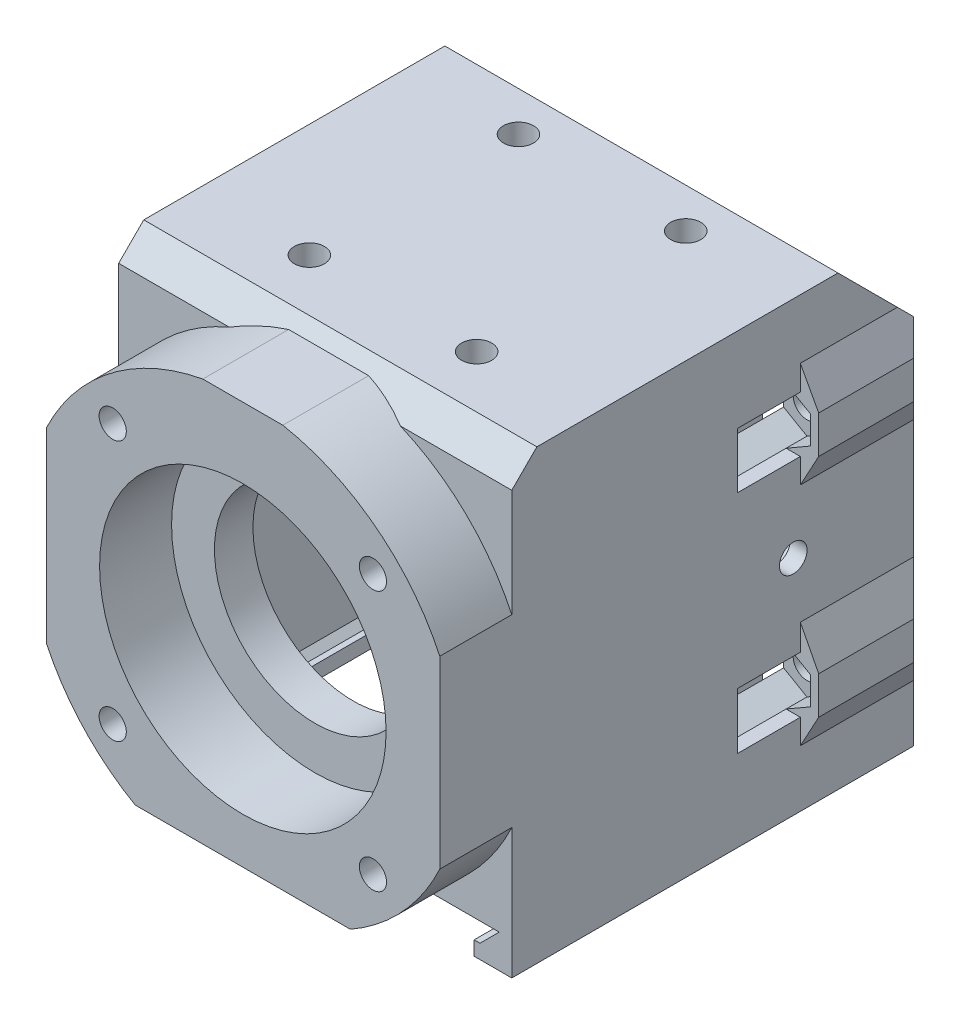
from build123d import *

# Parameters (mm, degrees)
SALIENTE_EXTRUIR11_DEPTH          = 4.6
SALIENTE_EXTRUIR12_DEPTH          = 48
CROQUIS13_W                       = 2.5
CROQUIS13_H                       = 3.996149892
SALIENTE_EXTRUIR16_DEPTH          = 40
REDONDEO1_SIZE                    = 1.5
REDONDEO1_SIZE_2                  = 5
CHAFL_N1_SIZE                     = 9
CORTAR_EXTRUIR4_DEPTH             = 37
CROQUIS15_R                       = 12
CORTAR_EXTRUIR6_DEPTH             = 4.6
CUT_EXTRUDE1_REACH                = 77.62
CUT_EXTRUDE1_DIRECTION_2_DEPTH    = 2
SKETCH2_R                         = 1.651428811
CUT_EXTRUDE2_DEPTH                = 11
CUT_EXTRUDE3_DEPTH                = 6
BOSS_EXTRUDE1_DEPTH               = 11
BOSS_EXTRUDE2_DEPTH               = 2.5
BOSS_EXTRUDE2_DEPTH_BACK          = 11
SKETCH6_W                         = 4.641732529
SKETCH6_H                         = 6.732997007
SKETCH6_W_2                       = 4.641448228
SKETCH6_H_2                       = 6.661529239
SKETCH6_W_3                       = 4.511392832
SKETCH6_H_3                       = 6.732997006
SKETCH6_W_4                       = 5.245953652
SKETCH6_H_4                       = 6.661529238
CUT_EXTRUDE4_DEPTH                = 3.5
CHAMFER1_SIZE                     = 2.19
CUT_EXTRUDE5_REACH                = 90.412
CORTAR_EXTRUIR7_DEPTH             = 21.498089
CORTAR_EXTRUIR7_DEPTH_BACK        = 21.498089
CROQUIS16_R                       = 1.65
CORTAR_EXTRUIR8_REACH             = 78.36
CROQUIS16_3_R                     = 1.65
CORTAR_EXTRUIR8_DIRECTION_2_REACH = 78.36
SALIENTE_EXTRUIR17_DEPTH          = 5.5
CHAFL_N2_SIZE                     = 2
CROQUIS19_R                       = 1.625
CROQUIS19_R_2                     = 17.125
SALIENTE_EXTRUIR18_DEPTH          = 8.606149892
CROQUIS20_R                       = 3
CORTAR_EXTRUIR9_DEPTH             = 10.206149892
CHAFL_N3_SIZE                     = 3
CHAFL_N4_SIZE                     = 4
CORTAR_EXTRUIR10_DEPTH            = 72.633260475
CHAFL_N5_SIZE                     = 1.8


with BuildPart() as part:
    # Croquis10 → Saliente-Extruir11 (new body)
    with BuildSketch(Plane.XY):
        Polygon((23.496383882, 3.993997574), (23.496905038, 53.492784374), (-23.503094962, 53.49282208), (-23.49750042, 3.993997574), align=None)
    extrude(amount=-SALIENTE_EXTRUIR11_DEPTH)

    # Croquis11 → Saliente-Extruir12 (add)
    with BuildSketch(Plane.XY):
        Polygon((-19.004304415, 46.48929276), (18.991873474, 46.49358723), (18.997129163, -0.007168252), (23.496341754, -0.007215623), (23.496905038, 53.492784374), (-23.503094962, 53.49282208), (-23.497048192, -0.007177578), (-18.999049268, -0.006669197), align=None)
    extrude(amount=-SALIENTE_EXTRUIR12_DEPTH)

    # Croquis13 → Saliente-Extruir16 (add)
    with BuildSketch(Plane(origin=(-0.005254636, 46.491440103, 0), x_dir=(0.9999999936128172, 0.0001130237387941988, 0), z_dir=(0.0001130237387941988, -0.9999999936128172, 0))):
        with Locations((-17.7490499, -46.001925054)):
            Rectangle(CROQUIS13_W, CROQUIS13_H)
        Polygon((17.000501156, -40.094972568), (17.000501156, -41.594973522), (18.9990499, -41.594973522), (18.9990499, -37.711974102), align=None)
        Polygon((-18.9990499, -37.711974102), (-17.000501156, -40.094972568), (-17.000501156, -41.594973522), (-18.9990499, -41.594973522), align=None)
        with Locations((17.7490499, -46.001925054)):
            Rectangle(CROQUIS13_W, CROQUIS13_H)
    extrude(amount=SALIENTE_EXTRUIR16_DEPTH)

    # Redondeo1
    # a fillet whose section is not a circle: 5, 1.5 mm, written as the material it takes off along each edge
    with BuildSketch(Plane(origin=(-4.501234814, 6.490931695, -41.594973522), x_dir=(0, 0, 1), z_dir=(-0.9999999936128172, -0.0001130237387941988, 0))) as redondeo1_piece_1:
        with BuildLine():
            Bezier((REDONDEO1_SIZE, 0), (0, 0), (0, REDONDEO1_SIZE_2), weights=[1, 0.707106781, 1])
            Line((0, REDONDEO1_SIZE_2), (0, 0))
            Line((0, 0), (REDONDEO1_SIZE, 0))
        make_face()
    extrude(amount=14.498548744, mode=Mode.SUBTRACT)
    with BuildSketch(Plane(origin=(-27.032212232, 6.48838516, -28.134391563), x_dir=(-0.00011302373879409797, 0.9999999936128171, 0), z_dir=(0.6425943013403179, 7.26284109292197e-05, -0.7662066030843527))) as redondeo1_piece_2_section:
        with BuildLine():
            Bezier((REDONDEO1_SIZE_2, 0), (0, 0), (0, -REDONDEO1_SIZE), weights=[1, 0.707106781, 1])
            Line((0, -REDONDEO1_SIZE), (0, 0))
            Line((0, 0), (REDONDEO1_SIZE_2, 0))
        make_face()
    redondeo1_piece_2 = extrude(amount=28.110125202, mode=Mode.PRIVATE)
    redondeo1_piece_2 = split(redondeo1_piece_2, bisect_by=Plane(origin=(-18.999783466, 6.489293015, -28.134391563), z_dir=(0.9999999936128172, 0.00011302373879382121, 0)), keep=Keep.TOP, mode=Mode.PRIVATE)
    add(redondeo1_piece_2, mode=Mode.SUBTRACT)
    with BuildSketch(Plane(origin=(-18.999783466, 6.489293015, -44.003850108), x_dir=(-0.00011302373879419882, 0.9999999936128173, 0), z_dir=(0.9999999936128172, 0.0001130237387941988, 0))) as redondeo1_piece_3:
        with BuildLine():
            Bezier((REDONDEO1_SIZE_2, 0), (0, 0), (0, -REDONDEO1_SIZE), weights=[1, 0.707106781, 1])
            Line((0, -REDONDEO1_SIZE), (0, 0))
            Line((0, 0), (REDONDEO1_SIZE_2, 0))
        make_face()
    extrude(amount=15, mode=Mode.SUBTRACT)
    with BuildSketch(Plane(origin=(18.996394423, 6.493587485, -44.003850108), x_dir=(0, 0, -1), z_dir=(-0.9999999936128172, -0.0001130237387941988, 0))) as redondeo1_piece_4:
        with BuildLine():
            Bezier((REDONDEO1_SIZE, 0), (0, 0), (0, -REDONDEO1_SIZE_2), weights=[1, 0.707106781, 1])
            Line((0, -REDONDEO1_SIZE_2), (0, 0))
            Line((0, 0), (REDONDEO1_SIZE, 0))
        make_face()
    extrude(amount=14.998078331, mode=Mode.SUBTRACT)
    with BuildSketch(Plane(origin=(4.49976744, 6.491949022, -41.594973522), x_dir=(-0.00011302373879419881, 0.9999999936128173, 0), z_dir=(0.9999999936128172, 0.0001130237387941988, 0))) as redondeo1_piece_5:
        with BuildLine():
            Bezier((REDONDEO1_SIZE_2, 0), (0, 0), (0, REDONDEO1_SIZE), weights=[1, 0.707106781, 1])
            Line((0, REDONDEO1_SIZE), (0, 0))
            Line((0, 0), (REDONDEO1_SIZE_2, 0))
        make_face()
    extrude(amount=14.496627075, mode=Mode.SUBTRACT)
    with BuildSketch(Plane(origin=(27.02882319, 6.49449534, -28.136682893), x_dir=(0.7662065981904509, 8.65995349694042e-05, -0.6425943054446852), z_dir=(-0.6425943013403179, -7.26284109292197e-05, -0.7662066030843527))) as redondeo1_piece_6_section:
        with BuildLine():
            Bezier((REDONDEO1_SIZE, 0), (0, 0), (0, -REDONDEO1_SIZE_2), weights=[1, 0.707106781, 1])
            Line((0, -REDONDEO1_SIZE_2), (0, 0))
            Line((0, 0), (REDONDEO1_SIZE, 0))
        make_face()
    redondeo1_piece_6 = extrude(amount=28.107134717, mode=Mode.PRIVATE)
    redondeo1_piece_6 = split(redondeo1_piece_6, bisect_by=Plane(origin=(18.996394423, 6.493587485, -28.136682893), z_dir=(-0.9999999936128172, -0.00011302373879380638, 0)), keep=Keep.TOP, mode=Mode.PRIVATE)
    add(redondeo1_piece_6, mode=Mode.SUBTRACT)

    # Chaflán1
    # the kernel refuses this chamfer: 9 mm, written as the material it takes off along each edge
    with BuildSketch(Plane(origin=(46.64205193, 53.492765806, -48), x_dir=(-8.022596244443855e-07, -0.999999999999678, 0), z_dir=(-0.9999999999996783, 8.022596244443856e-07, 0))) as chafl_n1_piece_1:
        Polygon((CHAFL_N1_SIZE, 0), (0, CHAFL_N1_SIZE), (0, 0), align=None)
    extrude(amount=93.290293783, mode=Mode.SUBTRACT)

    # Croquis14 → Cortar-Extruir4 (cut)
    with BuildSketch(Plane.XY):
        Polygon((18.99693689, 1.693999485), (19.699495603, 1.693999775), (21.999493409, 3.993997581), (18.996676936, 3.993997574), align=None)
        Polygon((-21.999502182, 3.993997591), (-19.699500787, 1.693999797), (-18.999241484, 1.693999797), (-18.999501438, 3.993997574), align=None)
    extrude(amount=-CORTAR_EXTRUIR4_DEPTH, mode=Mode.SUBTRACT)

    # Croquis15 → Cortar-Extruir6 (cut)
    with BuildSketch(Plane.XY):
        with Locations((-0.052055081, 26.591434374)):
            Circle(CROQUIS15_R)
    extrude(amount=-CORTAR_EXTRUIR6_DEPTH, mode=Mode.SUBTRACT)

    # Cut-Extrude1: up to this plane
    cut_extrude1_end = Plane(origin=(23.496905038, 53.492784374, -39), z_dir=(5.672832207026034e-07, 0.7071067811863239, -0.7071067811865436))
    # Sketch1 → Cut-Extrude1 (cut, up to the surface)
    with BuildSketch(Plane(origin=(5.11e-07, -0.004521854, 0), x_dir=(0.9999999936128173, 0.00011302373879411405, 0), z_dir=(0.00011302373879411405, -0.9999999936128173, 0)), mode=Mode.PRIVATE) as cut_extrude1_sk1:
        Polygon((-16.4990499, -45.503850108), (-20.063921392, -48), (-16.4990499, -48), align=None)
    cut_extrude1_tool1 = split(extrude(cut_extrude1_sk1.sketch, amount=-CUT_EXTRUDE1_REACH, mode=Mode.PRIVATE), bisect_by=cut_extrude1_end, keep=Keep.BOTH, mode=Mode.PRIVATE)
    add(cut_extrude1_tool1.solids().sort_by_distance((-17.68734, -0.006521, -47.16795))[0], mode=Mode.SUBTRACT)
    # Sketch1 → Cut-Extrude1 (cut, up to the surface)
    with BuildSketch(Plane(origin=(5.11e-07, -0.004521854, 0), x_dir=(0.9999999936128173, 0.00011302373879411405, 0), z_dir=(0.00011302373879411405, -0.9999999936128173, 0)), mode=Mode.PRIVATE) as cut_extrude1_sk2:
        Polygon((16.4990499, -45.503850108), (16.4990499, -48), (20.063921392, -48), align=None)
    cut_extrude1_tool2 = split(extrude(cut_extrude1_sk2.sketch, amount=-CUT_EXTRUDE1_REACH, mode=Mode.PRIVATE), bisect_by=cut_extrude1_end, keep=Keep.BOTH, mode=Mode.PRIVATE)
    add(cut_extrude1_tool2.solids().sort_by_distance((17.687341, -0.002523, -47.16795))[0], mode=Mode.SUBTRACT)

    # Sketch1 → Cut-Extrude1 direction 2 (cut)
    with BuildSketch(Plane(origin=(5.11e-07, -0.004521854, 0), x_dir=(0.9999999936128173, 0.00011302373879411405, 0), z_dir=(0.00011302373879411405, -0.9999999936128173, 0))):
        Polygon((-16.4990499, -45.503850108), (-20.063921392, -48), (-16.4990499, -48), align=None)
        Polygon((16.4990499, -45.503850108), (16.4990499, -48), (20.063921392, -48), align=None)
    extrude(amount=CUT_EXTRUDE1_DIRECTION_2_DEPTH, mode=Mode.SUBTRACT)

    # Sketch2 → Cut-Extrude2 (cut)
    with BuildSketch(Plane(origin=(0, 0, -37), x_dir=(-1, 0, 0), z_dir=(0, 0, -1))):
        with Locations(Location((-21.792312671, 13.089955334, 0), (0, 0, 180))):
            Circle(SKETCH2_R)
        with Locations(Location((-21.792596972, 40.092453426, 0), (0, 0, 180))):
            Circle(SKETCH2_R)
        with Locations((21.896707133, 13.090415321)):
            Circle(SKETCH2_R)
        with Locations((21.896422832, 40.092913413)):
            Circle(SKETCH2_R)
    extrude(amount=CUT_EXTRUDE2_DEPTH, mode=Mode.SUBTRACT)

    # Sketch3 → Cut-Extrude3 (cut)
    with BuildSketch(Plane(origin=(0, 0, -37), x_dir=(-1, 0, 0), z_dir=(0, 0, -1))):
        Polygon((-24.692596972, 38.418137645), (-21.792596972, 36.743821865), (-18.892596972, 38.418137645), (-18.892596972, 41.766769207), (-21.792596972, 43.441084987), (-24.692596972, 41.766769207), align=None)
        Polygon((-24.692312671, 14.764271115), (-24.692312671, 11.415639553), (-21.792312671, 9.741323773), (-18.892312671, 11.415639553), (-18.892312671, 14.764271115), (-21.792312671, 16.438586895), align=None)
        Polygon((24.796707133, 14.764731102), (21.896707133, 16.439046883), (18.996707133, 14.764731102), (18.996707133, 11.416099541), (21.896707133, 9.74178376), (24.796707133, 11.416099541), align=None)
        Polygon((24.796422832, 41.767229194), (21.896422832, 43.441544975), (18.996422832, 41.767229194), (18.996422832, 38.418597633), (21.896422832, 36.744281852), (24.796422832, 38.418597633), align=None)
    extrude(amount=-CUT_EXTRUDE3_DEPTH, mode=Mode.SUBTRACT)

    # Sketch4 → Boss-Extrude1 (add)
    with BuildSketch(Plane(origin=(0, 0, -37), x_dir=(-1, 0, 0), z_dir=(0, 0, -1))):
        with BuildLine():
            Line((21.896707133, 9.74178376), (24.796707133, 11.416099541))
            Line((24.796707133, 11.416099541), (24.796707133, 14.764731102))
            Line((24.796707133, 14.764731102), (21.896707133, 16.439046883))
            Line((21.896707133, 16.439046883), (21.896707133, 14.741844132))
            ThreePointArc((21.896707133, 14.741844132), (23.548135943, 13.090415321), (21.896707133, 11.438986511))
            Line((21.896707133, 11.438986511), (21.896707133, 9.74178376))
        make_face()
        with BuildLine():
            Line((21.896422832, 36.744281852), (24.796422832, 38.418597633))
            Line((24.796422832, 38.418597633), (24.796422832, 41.767229194))
            Line((24.796422832, 41.767229194), (21.896422832, 43.441544975))
            Line((21.896422832, 43.441544975), (21.896422832, 41.744342224))
            ThreePointArc((21.896422832, 41.744342224), (23.547851643, 40.092913413), (21.896422832, 38.441484603))
            Line((21.896422832, 38.441484603), (21.896422832, 36.744281852))
        make_face()
        with BuildLine():
            Line((-24.692312671, 11.415639553), (-21.792312671, 9.741323773))
            Line((-21.792312671, 9.741323773), (-21.792312671, 11.438526523))
            ThreePointArc((-21.792312671, 11.438526523), (-23.443741482, 13.089955334), (-21.792312671, 14.741384145))
            Line((-21.792312671, 14.741384145), (-21.792312671, 16.438586895))
            Line((-21.792312671, 16.438586895), (-24.692312671, 14.764271115))
            Line((-24.692312671, 14.764271115), (-24.692312671, 11.415639553))
        make_face()
        with BuildLine():
            Line((-24.692596972, 38.418137645), (-21.792596972, 36.743821865))
            Line((-21.792596972, 36.743821865), (-21.792596972, 38.441024615))
            ThreePointArc((-21.792596972, 38.441024615), (-23.444025782, 40.092453426), (-21.792596972, 41.743882237))
            Line((-21.792596972, 41.743882237), (-21.792596972, 43.441084987))
            Line((-21.792596972, 43.441084987), (-24.692596972, 41.766769207))
            Line((-24.692596972, 41.766769207), (-24.692596972, 38.418137645))
        make_face()
    extrude(amount=BOSS_EXTRUDE1_DEPTH)

    # Sketch5 → Boss-Extrude2 (add, two sides: drawn at the far end of the back side and taken through both)
    with BuildSketch(Plane.XY.offset(-37).offset(-BOSS_EXTRUDE2_DEPTH_BACK)):
        Polygon((-24.796422832, 41.767229194), (-21.896422832, 43.441544975), (-23.502273295, 46.222959565), (-25.796422832, 42.344579463), (-25.796422832, 37.841247364), (-23.500887885, 33.965266863), (-21.896422832, 36.744281852), (-24.796422832, 38.418597633), align=None)
        Polygon((-24.796707133, 14.764731102), (-21.896707133, 16.439046883), (-23.499232783, 19.321423675), (-25.796707133, 15.342081371), (-25.796707133, 10.838749272), (-23.497836614, 6.968546149), (-21.896707133, 9.74178376), (-24.796707133, 11.416099541), align=None)
        Polygon((24.692312671, 11.415639553), (21.792312671, 9.741323773), (23.496413317, 6.789734873), (25.692312671, 10.838289284), (25.692312671, 15.341621384), (23.496547988, 19.580665971), (21.792312671, 16.438586895), (24.692312671, 14.764271115), align=None)
        Polygon((24.692596972, 38.418137645), (21.792596972, 36.743821865), (23.496697617, 33.792232965), (25.692596972, 37.840787376), (25.692596972, 42.344119476), (23.496830286, 46.392903676), (21.792596972, 43.441084987), (24.692596972, 41.766769207), align=None)
    extrude(amount=BOSS_EXTRUDE2_DEPTH + BOSS_EXTRUDE2_DEPTH_BACK)

    # Sketch6 → Cut-Extrude4 (cut)
    with BuildSketch(Plane.XY.offset(-34.5)):
        with Locations((-24.217289097, 40.075046472)):
            Rectangle(SKETCH6_W, SKETCH6_H)
        with Locations((-24.217431247, 13.108282264)):
            Rectangle(SKETCH6_W_2, SKETCH6_H_2)
        with Locations((24.048009087, 13.107822276)):
            Rectangle(SKETCH6_W_3, SKETCH6_H_3)
        with Locations((24.415573798, 40.074586484)):
            Rectangle(SKETCH6_W_4, SKETCH6_H_4)
    extrude(amount=CUT_EXTRUDE4_DEPTH, mode=Mode.SUBTRACT)

    # Chamfer1
    chamfer1_edges = [part.edges().sort_by_distance(p)[0] for p in [
        (-25.796422832, 40.092913413, -48),
        (-25.796707133, 13.090415321, -48),
        (25.692312671, 13.089955334, -48),
        (25.692596972, 40.092453426, -48),
    ]]
    chamfer(chamfer1_edges, length=CHAMFER1_SIZE)

    # Cut-Extrude5: up to this face of the body (flat: up to its plane)
    cut_extrude5_end = Plane(part.part.faces().sort_by_distance((-25.796422832, 40.092913413, -40.155))[0])
    # Sketch8 → Cut-Extrude5 (cut, up to the picked face)
    with BuildSketch(Plane(origin=(25.692596972, 0, 0), x_dir=(0, 0, -1), z_dir=(1, 0, 0)), mode=Mode.PRIVATE) as cut_extrude5_sk1:
        Polygon((48, 44.492784374), (39, 53.492784374), (48, 53.492784374), align=None)
    cut_extrude5_tool1 = split(extrude(cut_extrude5_sk1.sketch, amount=-CUT_EXTRUDE5_REACH, mode=Mode.PRIVATE), bisect_by=cut_extrude5_end, keep=Keep.BOTH, mode=Mode.PRIVATE)
    add(cut_extrude5_tool1.solids().sort_by(Axis((25.692597, 50.492784, -45), (-1, 0, 0)))[0], mode=Mode.SUBTRACT)

    # Croquis16 → Cortar-Extruir7 (cut, two sides: drawn at the far end of the back side and taken through both)
    # profile 1 of 2: a face of its own
    with BuildSketch(Plane(origin=(-0.000960834, -1.09e-07, 0), x_dir=(0, 0, 1), z_dir=(-0.9999999936128173, -0.00011302373879384934, 0)).offset(-CORTAR_EXTRUIR7_DEPTH_BACK)):
        Polygon((-36.454091828, 25.02942041), (-33.654091828, 23.412839656), (-30.854091828, 25.02942041), (-30.854091828, 28.262581917), (-33.654091828, 29.879162671), (-36.454091828, 28.262581917), align=None)
        with Locations((-33.654091828, 26.646001163)):
            Circle(CROQUIS16_R, mode=Mode.SUBTRACT)
    # profile 2 of 2: a face of its own
    with BuildSketch(Plane(origin=(-0.000960834, -1.09e-07, 0), x_dir=(0, 0, 1), z_dir=(-0.9999999936128173, -0.00011302373879384934, 0)).offset(-CORTAR_EXTRUIR7_DEPTH_BACK)):
        with Locations((-33.654091828, 26.646001163)):
            Circle(CROQUIS16_R)
    extrude(amount=CORTAR_EXTRUIR7_DEPTH + CORTAR_EXTRUIR7_DEPTH_BACK, mode=Mode.SUBTRACT)

    # Cortar-Extruir8: up to this face of the body (flat: up to its plane)
    cortar_extruir8_end = Plane(part.part.faces().sort_by_distance((23.496619229, 26.346972028, -20.666914974))[0])
    # Croquis16<3> → Cortar-Extruir8 (cut, up to the picked face)
    with BuildSketch(Plane(origin=(-0.000960834, -1.09e-07, 0), x_dir=(0, 0, 1), z_dir=(-0.9999999936128173, -0.00011302373879384934, 0)), mode=Mode.PRIVATE) as cortar_extruir8_sk1:
        with Locations(Location((-33.654091828, 26.646001163, 0), (0, 0, 270))):
            Circle(CROQUIS16_3_R)
    cortar_extruir8_tool1 = split(extrude(cortar_extruir8_sk1.sketch, amount=-CORTAR_EXTRUIR8_REACH, mode=Mode.PRIVATE), bisect_by=cortar_extruir8_end, keep=Keep.BOTH, mode=Mode.PRIVATE)
    add(cortar_extruir8_tool1.solids().sort_by(Axis((-0.003972, 26.646001, -33.654092), (0.9999999936128173, 0.00011302373879384934, 0)))[0], mode=Mode.SUBTRACT)

    # Cortar-Extruir8 direction 2: up to this face of the body (flat: up to its plane)
    cortar_extruir8_direction_2_end = Plane(part.part.faces().sort_by_distance((-23.500025755, 26.337401196, -20.76406833))[0])
    # Croquis16<3> → Cortar-Extruir8 direction 2 (cut, up to the picked face)
    with BuildSketch(Plane(origin=(-0.000960834, -1.09e-07, 0), x_dir=(0, 0, 1), z_dir=(-0.9999999936128173, -0.00011302373879384934, 0)), mode=Mode.PRIVATE) as cortar_extruir8_direction_2_sk1:
        with Locations(Location((-33.654091828, 26.646001163, 0), (0, 0, 270))):
            Circle(CROQUIS16_3_R)
    cortar_extruir8_direction_2_tool1 = split(extrude(cortar_extruir8_direction_2_sk1.sketch, amount=CORTAR_EXTRUIR8_DIRECTION_2_REACH, mode=Mode.PRIVATE), bisect_by=cortar_extruir8_direction_2_end, keep=Keep.BOTH, mode=Mode.PRIVATE)
    add(cortar_extruir8_direction_2_tool1.solids().sort_by(Axis((-0.003972, 26.646001, -33.654092), (-0.9999999936128173, -0.00011302373879384934, 0)))[0], mode=Mode.SUBTRACT)

    # Croquis18 → Saliente-Extruir17 (add)
    with BuildSketch(Plane.XY.offset(-34.5)):
        Polygon((-17.996707133, 10.838749272), (-17.996707133, 15.342081371), (-19.00123784, 19.357157559), (-18.999841671, 7.004280033), align=None)
        Polygon((-17.996991433, 37.841247364), (-17.996991433, 42.344579463), (-19.004270273, 46.187210327), (-19.002884866, 33.92954827), align=None)
        Polygon((17.892028371, 42.344119476), (17.892028371, 37.840787376), (18.993303851, 33.838037966), (18.991888893, 46.357162086), align=None)
        Polygon((17.892312671, 15.341621384), (17.892312671, 10.838289284), (18.996356912, 6.825476404), (18.994911236, 19.616379463), align=None)
    extrude(amount=SALIENTE_EXTRUIR17_DEPTH)

    # Chaflán2
    # the kernel refuses this chamfer: 2 mm, written as the material it takes off along each edge
    with BuildSketch(Plane(origin=(17.892312671, 24.085343543, -29), x_dir=(1, 0, 0), z_dir=(0, -1, 0))) as chafl_n2_piece_1_section:
        Polygon((CHAFL_N2_SIZE, 0), (0, -CHAFL_N2_SIZE), (0, 0), align=None)
    chafl_n2_piece_1 = extrude(amount=21.990776418, mode=Mode.PRIVATE)
    chafl_n2_piece_1 = split(chafl_n2_piece_1, bisect_by=Plane(origin=(18.994406123, 24.085468106, -29), z_dir=(-0.9999999936128172, -0.00011302373879380638, 0)), keep=Keep.TOP, mode=Mode.PRIVATE)
    add(chafl_n2_piece_1, mode=Mode.SUBTRACT)
    with BuildSketch(Plane(origin=(17.892028371, 51.087841635, -29), x_dir=(1, 0, 0), z_dir=(0, -1, 0))) as chafl_n2_piece_2_section:
        Polygon((CHAFL_N2_SIZE, 0), (0, -CHAFL_N2_SIZE), (0, 0), align=None)
    chafl_n2_piece_2 = extrude(amount=21.990776418, mode=Mode.PRIVATE)
    chafl_n2_piece_2 = split(chafl_n2_piece_2, bisect_by=Plane(origin=(18.9913542, 51.087965885, -29), z_dir=(-0.9999999936128172, -0.00011302373879380638, 0)), keep=Keep.TOP, mode=Mode.PRIVATE)
    chafl_n2_piece_2 = split(chafl_n2_piece_2, bisect_by=Plane(origin=(20.121003383, 50.476943157, -29), z_dir=(0.964433981018018, -0.2643238473118486, 0)), keep=Keep.TOP, mode=Mode.PRIVATE)
    add(chafl_n2_piece_2, mode=Mode.SUBTRACT)
    with BuildSketch(Plane(origin=(-17.996991433, 29.097525205, -29), x_dir=(-1, 0, 0), z_dir=(0, 1, 0))) as chafl_n2_piece_3_section:
        Polygon((CHAFL_N2_SIZE, 0), (0, -CHAFL_N2_SIZE), (0, 0), align=None)
    chafl_n2_piece_3 = extrude(amount=21.990776418, mode=Mode.PRIVATE)
    chafl_n2_piece_3 = split(chafl_n2_piece_3, bisect_by=Plane(origin=(-19.00233872, 29.097411576, -29), z_dir=(0.9999999936128172, 0.00011302373879382121, 0)), keep=Keep.TOP, mode=Mode.PRIVATE)
    chafl_n2_piece_3 = split(chafl_n2_piece_3, bisect_by=Plane(origin=(-14.747771848, 29.9492516, -29), z_dir=(-0.9673181836652276, -0.25356563558693246, 0)), keep=Keep.TOP, mode=Mode.PRIVATE)
    add(chafl_n2_piece_3, mode=Mode.SUBTRACT)
    with BuildSketch(Plane(origin=(-17.996707133, 2.095027113, -29), x_dir=(-1, 0, 0), z_dir=(0, 1, 0))) as chafl_n2_piece_4_section:
        Polygon((CHAFL_N2_SIZE, 0), (0, -CHAFL_N2_SIZE), (0, 0), align=None)
    chafl_n2_piece_4 = extrude(amount=21.990776418, mode=Mode.PRIVATE)
    chafl_n2_piece_4 = split(chafl_n2_piece_4, bisect_by=Plane(origin=(-18.999286796, 2.094913797, -29), z_dir=(0.9999999936128172, 0.00011302373879382121, 0)), keep=Keep.TOP, mode=Mode.PRIVATE)
    add(chafl_n2_piece_4, mode=Mode.SUBTRACT)

    # Croquis19 → Saliente-Extruir18 (add)
    with BuildSketch(Plane.XY):
        with BuildLine():
            Line((-23.501323818, 37.822275646), (-23.498784516, 15.355292741))
            ThreePointArc((-23.498784516, 15.355292741), (-19.073034137, 8.86568035), (-12.911131644, 3.993997574))
            Line((-12.911131644, 3.993997574), (12.807021398, 3.993997525))
            ThreePointArc((12.807021398, 3.993997525), (19.049822846, 8.952889659), (23.496505765, 15.570305479))
            Line((23.496505765, 15.570305479), (23.496737835, 37.612067396))
            ThreePointArc((23.496737835, 37.612067396), (15.869270705, 47.146516111), (4.730539653, 52.147779723))
            Line((4.730539653, 52.147779723), (-4.834608809, 52.147787397))
            ThreePointArc((-4.834608809, 52.147787397), (-15.881269264, 47.217533819), (-23.501323818, 37.822275646))
        make_face()
        with Locations(Location((15.504281625, 11.035072707, 0), (0, 0, 179.999954034))):
            Circle(CROQUIS19_R, mode=Mode.SUBTRACT)
        with Locations(Location((15.504306586, 42.14777108, 0), (0, 0, 179.999954034))):
            Circle(CROQUIS19_R, mode=Mode.SUBTRACT)
        with Locations(Location((-15.608416747, 11.035097668, 0), (0, 0, 179.999954034))):
            Circle(CROQUIS19_R, mode=Mode.SUBTRACT)
        with Locations(Location((-15.608391787, 42.14779604, 0), (0, 0, 179.999954034))):
            Circle(CROQUIS19_R, mode=Mode.SUBTRACT)
        with Locations(Location((-0.052055081, 26.591434374, 0), (0, 0, 90))):
            Circle(CROQUIS19_R_2, mode=Mode.SUBTRACT)
    extrude(amount=SALIENTE_EXTRUIR18_DEPTH)

    # Croquis20 → Cortar-Extruir9 (cut)
    with BuildSketch(Plane(origin=(0, 0, -4.6), x_dir=(-1, 0, 0), z_dir=(0, 0, -1))):
        with Locations((15.608416747, 11.035097668)):
            Circle(CROQUIS20_R)
        with Locations((-15.504281625, 11.035072707)):
            Circle(CROQUIS20_R)
        with Locations((-15.504306586, 42.14777108)):
            Circle(CROQUIS20_R)
        with Locations((15.608391787, 42.14779604)):
            Circle(CROQUIS20_R)
    extrude(amount=-CORTAR_EXTRUIR9_DEPTH, mode=Mode.SUBTRACT)

    # Chaflán3
    # the kernel refuses this chamfer: 3 mm, written as the material it takes off along each edge
    with BuildSketch(Plane(origin=(31.211954002, 53.492778185, 0), x_dir=(0, 0, -1), z_dir=(-0.9999999999996783, 8.022596244443856e-07, 0))) as chafl_n3_piece_1_section:
        Polygon((CHAFL_N3_SIZE, 0), (0, CHAFL_N3_SIZE), (0, 0), align=None)
    chafl_n3_piece_1 = extrude(amount=62.430097928, mode=Mode.PRIVATE)
    chafl_n3_piece_1 = chafl_n3_piece_1 - Plane(origin=(-0.052055081, 26.591434374, 0), x_dir=(0.9057228044575872, 0.42387050084369327, 0), z_dir=(0, 0, -1)) * Cylinder(26, 137, mode=Mode.PRIVATE)
    add(chafl_n3_piece_1, mode=Mode.SUBTRACT)
    with BuildSketch(Plane(origin=(31.211954002, 53.492778185, 0), x_dir=(0, 0, -1), z_dir=(-0.9999999999996783, 8.022596244443856e-07, 0))) as chafl_n3_piece_2_section:
        Polygon((CHAFL_N3_SIZE, 0), (0, CHAFL_N3_SIZE), (0, 0), align=None)
    chafl_n3_piece_2 = extrude(amount=62.430097928, mode=Mode.PRIVATE)
    chafl_n3_piece_2 = split(chafl_n3_piece_2, bisect_by=Plane(origin=(31.211952923, 52.147758478, 0), z_dir=(8.022596243198461e-07, 0.9999999999996783, 0)), keep=Keep.TOP, mode=Mode.PRIVATE)
    add(chafl_n3_piece_2, mode=Mode.SUBTRACT)

    # Chaflán4
    # the kernel refuses this chamfer: 4 mm, written as the material it takes off along each edge
    with BuildSketch(Plane(origin=(-23.503121574, 53.728276861, -31), x_dir=(0.9999999936128172, 0.00011302373879429364, 0), z_dir=(0.00011302373879429364, -0.9999999936128172, 0))) as chafl_n4_piece_1_section:
        Polygon((CHAFL_N4_SIZE, 0), (0, CHAFL_N4_SIZE), (0, 0), align=None)
    chafl_n4_piece_1 = extrude(amount=27.306460953, mode=Mode.PRIVATE)
    chafl_n4_piece_1 = split(chafl_n4_piece_1, bisect_by=Plane(origin=(-23.503121574, 36.708547968, -31), z_dir=(0, 1, 0)), keep=Keep.TOP, mode=Mode.PRIVATE)
    chafl_n4_piece_1 = split(chafl_n4_piece_1, bisect_by=Plane(origin=(-23.503121574, 43.441544975, -31), z_dir=(0, -1, 0)), keep=Keep.TOP, mode=Mode.PRIVATE)
    chafl_n4_piece_1 = split(chafl_n4_piece_1, bisect_by=Plane(origin=(-15.747161321, 40.294559641, -31), z_dir=(-0.5000000000000002, 0.8660254037844386, 0)), keep=Keep.TOP, mode=Mode.PRIVATE)
    chafl_n4_piece_1 = split(chafl_n4_piece_1, bisect_by=Plane(origin=(-27.555732456, 46.708948909, -31), z_dir=(-0.5000000000000018, -0.8660254037844376, 0)), keep=Keep.TOP, mode=Mode.PRIVATE)
    add(chafl_n4_piece_1, mode=Mode.SUBTRACT)
    with BuildSketch(Plane(origin=(-23.503121574, 53.728276861, -31), x_dir=(0.9999999936128172, 0.00011302373879429364, 0), z_dir=(0.00011302373879429364, -0.9999999936128172, 0))) as chafl_n4_piece_2_section:
        Polygon((CHAFL_N4_SIZE, 0), (0, CHAFL_N4_SIZE), (0, 0), align=None)
    chafl_n4_piece_2 = extrude(amount=27.306460953, mode=Mode.PRIVATE)
    chafl_n4_piece_2 = split(chafl_n4_piece_2, bisect_by=Plane(origin=(-23.503121574, 36.708547968, -31), z_dir=(0, 1, 0)), keep=Keep.TOP, mode=Mode.PRIVATE)
    chafl_n4_piece_2 = split(chafl_n4_piece_2, bisect_by=Plane(origin=(-21.896422832, 53.728276861, -31), z_dir=(-1, 0, 0)), keep=Keep.TOP, mode=Mode.PRIVATE)
    chafl_n4_piece_2 = split(chafl_n4_piece_2, bisect_by=Plane(origin=(-15.747161321, 40.294559641, -31), z_dir=(0.5000000000000002, -0.8660254037844386, 0)), keep=Keep.TOP, mode=Mode.PRIVATE)
    add(chafl_n4_piece_2, mode=Mode.SUBTRACT)
    with BuildSketch(Plane(origin=(-23.500069651, 26.725778769, -31), x_dir=(0.9999999936128172, 0.00011302373879398327, 0), z_dir=(0.00011302373879398327, -0.9999999936128172, 0))) as chafl_n4_piece_3_section:
        Polygon((CHAFL_N4_SIZE, 0), (0, CHAFL_N4_SIZE), (0, 0), align=None)
    chafl_n4_piece_3 = extrude(amount=27.234993185, mode=Mode.PRIVATE)
    chafl_n4_piece_3 = split(chafl_n4_piece_3, bisect_by=Plane(origin=(-23.500069651, 16.439046883, -31), z_dir=(0, -1, 0)), keep=Keep.TOP, mode=Mode.PRIVATE)
    chafl_n4_piece_3 = split(chafl_n4_piece_3, bisect_by=Plane(origin=(-23.500069651, 9.777517644, -31), z_dir=(0, 1, 0)), keep=Keep.TOP, mode=Mode.PRIVATE)
    chafl_n4_piece_3 = split(chafl_n4_piece_3, bisect_by=Plane(origin=(-15.744943453, 13.293506176, -31), z_dir=(-0.5000000000000002, 0.8660254037844386, 0)), keep=Keep.TOP, mode=Mode.PRIVATE)
    chafl_n4_piece_3 = split(chafl_n4_piece_3, bisect_by=Plane(origin=(-27.553514589, 19.70500619, -31), z_dir=(-0.5000000000000007, -0.8660254037844384, 0)), keep=Keep.TOP, mode=Mode.PRIVATE)
    add(chafl_n4_piece_3, mode=Mode.SUBTRACT)
    with BuildSketch(Plane(origin=(-23.500069651, 26.725778769, -31), x_dir=(0.9999999936128172, 0.00011302373879398327, 0), z_dir=(0.00011302373879398327, -0.9999999936128172, 0))) as chafl_n4_piece_4_section:
        Polygon((CHAFL_N4_SIZE, 0), (0, CHAFL_N4_SIZE), (0, 0), align=None)
    chafl_n4_piece_4 = extrude(amount=27.234993185, mode=Mode.PRIVATE)
    chafl_n4_piece_4 = split(chafl_n4_piece_4, bisect_by=Plane(origin=(-30.453514589, 14.682058848, -31), z_dir=(0.4999999999999997, 0.8660254037844388, 0)), keep=Keep.TOP, mode=Mode.PRIVATE)
    chafl_n4_piece_4 = split(chafl_n4_piece_4, bisect_by=Plane(origin=(-23.500069651, 9.777517644, -31), z_dir=(0, -1, 0)), keep=Keep.TOP, mode=Mode.PRIVATE)
    chafl_n4_piece_4 = split(chafl_n4_piece_4, bisect_by=Plane(origin=(-15.744943453, 13.293506176, -31), z_dir=(-0.5000000000000002, 0.8660254037844386, 0)), keep=Keep.TOP, mode=Mode.PRIVATE)
    add(chafl_n4_piece_4, mode=Mode.SUBTRACT)
    with BuildSketch(Plane(origin=(23.496620388, 26.457089913, -31), x_dir=(-0.9999999999445736, 1.0528674286671403e-05, 0), z_dir=(1.0528674286671403e-05, 0.9999999999445736, 0))) as chafl_n4_piece_5_section:
        Polygon((CHAFL_N4_SIZE, 0), (0, CHAFL_N4_SIZE), (0, 0), align=None)
    chafl_n4_piece_5 = extrude(amount=27.234993143, mode=Mode.PRIVATE)
    chafl_n4_piece_5 = split(chafl_n4_piece_5, bisect_by=Plane(origin=(23.496620388, 43.405351103, -31), z_dir=(0, -1, 0)), keep=Keep.TOP, mode=Mode.PRIVATE)
    chafl_n4_piece_5 = split(chafl_n4_piece_5, bisect_by=Plane(origin=(23.496620388, 36.743821865, -31), z_dir=(0, 1, 0)), keep=Keep.TOP, mode=Mode.PRIVATE)
    chafl_n4_piece_5 = split(chafl_n4_piece_5, bisect_by=Plane(origin=(15.716328938, 39.932950003, -31), z_dir=(0.5000000000000002, -0.8660254037844386, 0)), keep=Keep.TOP, mode=Mode.PRIVATE)
    chafl_n4_piece_5 = split(chafl_n4_piece_5, bisect_by=Plane(origin=(27.52490013, 33.434275093, -31), z_dir=(0.5000000000000009, 0.8660254037844382, 0)), keep=Keep.TOP, mode=Mode.PRIVATE)
    add(chafl_n4_piece_5, mode=Mode.SUBTRACT)
    with BuildSketch(Plane(origin=(23.496620388, 26.457089913, -31), x_dir=(-0.9999999999445736, 1.0528674286671403e-05, 0), z_dir=(1.0528674286671403e-05, 0.9999999999445736, 0))) as chafl_n4_piece_6_section:
        Polygon((CHAFL_N4_SIZE, 0), (0, CHAFL_N4_SIZE), (0, 0), align=None)
    chafl_n4_piece_6 = extrude(amount=27.234993143, mode=Mode.PRIVATE)
    chafl_n4_piece_6 = split(chafl_n4_piece_6, bisect_by=Plane(origin=(30.42490013, 38.457222435, -31), z_dir=(-0.5000000000000004, -0.8660254037844384, 0)), keep=Keep.TOP, mode=Mode.PRIVATE)
    chafl_n4_piece_6 = split(chafl_n4_piece_6, bisect_by=Plane(origin=(23.496620388, 36.743821865, -31), z_dir=(0, 1, 0)), keep=Keep.TOP, mode=Mode.PRIVATE)
    chafl_n4_piece_6 = split(chafl_n4_piece_6, bisect_by=Plane(origin=(15.716328938, 39.932950003, -31), z_dir=(0.5000000000000002, -0.8660254037844386, 0)), keep=Keep.TOP, mode=Mode.PRIVATE)
    chafl_n4_piece_6 = split(chafl_n4_piece_6, bisect_by=Plane(origin=(27.52490013, 33.434275093, -31), z_dir=(0.5000000000000009, 0.8660254037844382, 0)), keep=Keep.TOP, mode=Mode.PRIVATE)
    add(chafl_n4_piece_6, mode=Mode.SUBTRACT)
    with BuildSketch(Plane(origin=(23.496336088, -0.545408179, -31), x_dir=(-0.9999999999445736, 1.0528674286518803e-05, 0), z_dir=(1.0528674286518803e-05, 0.9999999999445736, 0))) as chafl_n4_piece_7_section:
        Polygon((CHAFL_N4_SIZE, 0), (0, CHAFL_N4_SIZE), (0, 0), align=None)
    chafl_n4_piece_7 = extrude(amount=27.306460911, mode=Mode.PRIVATE)
    chafl_n4_piece_7 = split(chafl_n4_piece_7, bisect_by=Plane(origin=(15.716044638, 12.930451911, -31), z_dir=(0.4999999999999998, -0.8660254037844388, 0)), keep=Keep.TOP, mode=Mode.PRIVATE)
    chafl_n4_piece_7 = split(chafl_n4_piece_7, bisect_by=Plane(origin=(23.496336088, 9.741323773, -31), z_dir=(0, 1, 0)), keep=Keep.TOP, mode=Mode.PRIVATE)
    chafl_n4_piece_7 = split(chafl_n4_piece_7, bisect_by=Plane(origin=(23.496336088, 16.474320779, -31), z_dir=(0, -1, 0)), keep=Keep.TOP, mode=Mode.PRIVATE)
    chafl_n4_piece_7 = split(chafl_n4_piece_7, bisect_by=Plane(origin=(27.524615829, 6.431777001, -31), z_dir=(0.5000000000000001, 0.8660254037844386, 0)), keep=Keep.TOP, mode=Mode.PRIVATE)
    add(chafl_n4_piece_7, mode=Mode.SUBTRACT)
    with BuildSketch(Plane(origin=(23.496336088, -0.545408179, -31), x_dir=(-0.9999999999445736, 1.0528674286518803e-05, 0), z_dir=(1.0528674286518803e-05, 0.9999999999445736, 0))) as chafl_n4_piece_8_section:
        Polygon((CHAFL_N4_SIZE, 0), (0, CHAFL_N4_SIZE), (0, 0), align=None)
    chafl_n4_piece_8 = extrude(amount=27.306460911, mode=Mode.PRIVATE)
    chafl_n4_piece_8 = split(chafl_n4_piece_8, bisect_by=Plane(origin=(23.496336088, 9.741323773, -31), z_dir=(0, 1, 0)), keep=Keep.TOP, mode=Mode.PRIVATE)
    chafl_n4_piece_8 = split(chafl_n4_piece_8, bisect_by=Plane(origin=(23.496336088, 16.474320779, -31), z_dir=(0, -1, 0)), keep=Keep.TOP, mode=Mode.PRIVATE)
    chafl_n4_piece_8 = split(chafl_n4_piece_8, bisect_by=Plane(origin=(21.792312671, -0.545408179, -31), z_dir=(1, 0, 0)), keep=Keep.TOP, mode=Mode.PRIVATE)
    add(chafl_n4_piece_8, mode=Mode.SUBTRACT)

    # Croquis21 → Cortar-Extruir10 (cut, through all)
    with BuildSketch(Plane(origin=(-0.005254636, 46.491440103, 0), x_dir=(0.9999999936128173, 0.00011302373879419885, 0), z_dir=(0.00011302373879419885, -0.9999999936128173, 0))):
        with BuildLine():
            add(Edge.make_bspline(
                [(-9.947048941, -32.45), (-13.547048917, -32.45), (-13.547048917, -36.05), (-9.947048941, -36.05), (-6.347048964, -36.05), (-6.347048964, -32.45), (-9.947048941, -32.45)],
                knots=[0, 0, 0, 0, 0.5, 0.5, 0.5, 1, 1, 1, 1], degree=3, weights=[1, 0.333333333, 0.333333333, 1, 0.333333333, 0.333333333, 1]))
        make_face()
        with BuildLine():
            add(Edge.make_bspline(
                [(10.05295093, -32.45), (6.452950953, -32.45), (6.452950953, -36.05), (10.05295093, -36.05), (13.652950906, -36.05), (13.652950906, -32.45), (10.05295093, -32.45)],
                knots=[0, 0, 0, 0, 0.5, 0.5, 0.5, 1, 1, 1, 1], degree=3, weights=[1, 0.333333333, 0.333333333, 1, 0.333333333, 0.333333333, 1]))
        make_face()
        with BuildLine():
            add(Edge.make_bspline(
                [(-9.947048941, -7.45), (-13.547048917, -7.45), (-13.547048917, -11.05), (-9.947048941, -11.05), (-6.347048964, -11.05), (-6.347048964, -7.45), (-9.947048941, -7.45)],
                knots=[0, 0, 0, 0, 0.5, 0.5, 0.5, 1, 1, 1, 1], degree=3, weights=[1, 0.333333333, 0.333333333, 1, 0.333333333, 0.333333333, 1]))
        make_face()
        with BuildLine():
            add(Edge.make_bspline(
                [(10.05295093, -7.45), (6.452950953, -7.45), (6.452950953, -11.05), (10.05295093, -11.05), (13.652950906, -11.05), (13.652950906, -7.45), (10.05295093, -7.45)],
                knots=[0, 0, 0, 0, 0.5, 0.5, 0.5, 1, 1, 1, 1], degree=3, weights=[1, 0.333333333, 0.333333333, 1, 0.333333333, 0.333333333, 1]))
        make_face()
    extrude(amount=-CORTAR_EXTRUIR10_DEPTH, mode=Mode.SUBTRACT)

    # Chaflán5
    # the kernel refuses this chamfer: 1.8 mm, written as the material it takes off along each edge
    with BuildSketch(Plane(origin=(-9.952303514, 46.490315851, -34.249999995), x_dir=(0, 0, 1), z_dir=(0.9999999936128173, 0.00011302373879467183, 4.9343245351593294e-15))) as chafl_n5_piece_1:
        Polygon((1.799999995 + CHAFL_N5_SIZE, 0), (1.799999995 + CHAFL_N5_SIZE * 5.18254081625e-09, -CHAFL_N5_SIZE), (1.799999995, 0), align=None)
    revolve(axis=Axis((-9.952303514, 46.490315851, -34.249999995), (0.00011302373879467183, -0.9999999936128173, 0)), mode=Mode.SUBTRACT)
    with BuildSketch(Plane(origin=(10.047696229, 46.492576325, -34.249999995), x_dir=(0, 0, 1), z_dir=(0.9999999936128171, 0.00011302373879467148, 0))) as chafl_n5_piece_2:
        Polygon((1.799999995 + CHAFL_N5_SIZE, 0), (1.799999995 + CHAFL_N5_SIZE * 5.18254476371e-09, -CHAFL_N5_SIZE), (1.799999995, 0), align=None)
    revolve(axis=Axis((10.047696229, 46.492576325, -34.249999995), (0.00011302373879467148, -0.9999999936128171, 0)), mode=Mode.SUBTRACT)
    with BuildSketch(Plane(origin=(-9.952303514, 46.490315851, -9.249999995), x_dir=(0, 0, 1), z_dir=(0.9999999936128173, 0.0001130237387946718, 1.9737298140637324e-15))) as chafl_n5_piece_3:
        Polygon((1.799999995 + CHAFL_N5_SIZE, 0), (1.799999995 + CHAFL_N5_SIZE * 5.18254377684e-09, -CHAFL_N5_SIZE), (1.799999995, 0), align=None)
    revolve(axis=Axis((-9.952303514, 46.490315851, -9.249999995), (0.0001130237387946718, -0.9999999936128173, 0)), mode=Mode.SUBTRACT)
    with BuildSketch(Plane(origin=(10.047696229, 46.492576325, -9.249999995), x_dir=(0, 0, 1), z_dir=(0.9999999936128171, 0.00011302373879467173, 3.9474596281274625e-15))) as chafl_n5_piece_4:
        Polygon((1.799999995 + CHAFL_N5_SIZE, 0), (1.799999995 + CHAFL_N5_SIZE * 5.18254377684e-09, -CHAFL_N5_SIZE), (1.799999995, 0), align=None)
    revolve(axis=Axis((10.047696229, 46.492576325, -9.249999995), (0.00011302373879467173, -0.9999999936128171, 0)), mode=Mode.SUBTRACT)


solid = part.part
